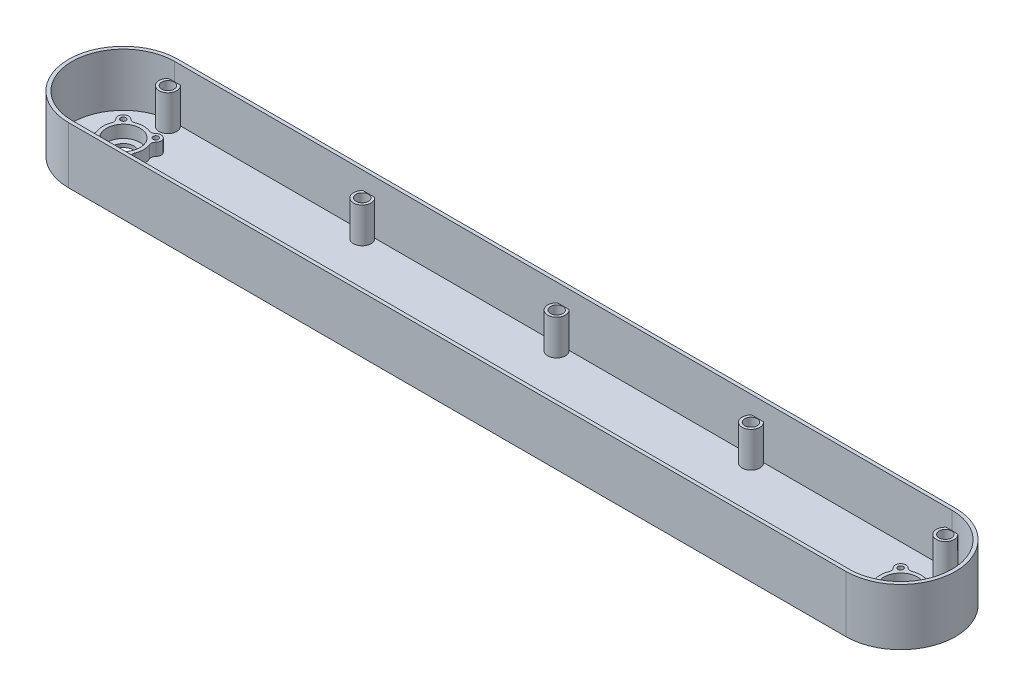
from build123d import *

# Parameters (mm, degrees)
BOSS_EXTRUDE1_DEPTH   = 30
SKETCH2_R             = 9.5
SKETCH2_R_2           = 1.5
BOSS_EXTRUDE2_DEPTH   = 7
BOSS_EXTRUDE2_2_DEPTH = 7
BOSS_EXTRUDE3_START   = -2
SKETCH3_3_R           = 2
BOSS_EXTRUDE3_DEPTH   = 2
SKETCH2_5_R           = 6
CUT_EXTRUDE2_DEPTH    = 3
SKETCH3_6_R           = 3.5
BOSS_EXTRUDE15_DEPTH  = 20
SKETCH3_10_R          = 3.5
SKETCH3_10_R_2        = 2
BOSS_EXTRUDE16_DEPTH  = 15
CUT_EXTRUDE3_START    = -2
SKETCH3_11_R          = 3.5
CUT_EXTRUDE3_DEPTH    = 3
LPATTERN3_COUNT       = 3
LPATTERN3_PITCH       = 110
LPATTERN3_COL_COUNT   = 3
LPATTERN3_COL_PITCH   = 110


with BuildPart() as part:
    # Sketch3 → Boss-Extrude1 (new body)
    with BuildSketch(Plane(origin=(0, 0, 0), x_dir=(1, 0, 0), z_dir=(0, 1, 0))):
        with BuildLine():
            Line((220, 31), (-220, 31))
            ThreePointArc((-220, 31), (-251, 0), (-220, -31))
            Line((-220, -31), (220, -31))
            ThreePointArc((220, -31), (251, 0), (220, 31))
        make_face()
        with BuildLine():
            Line((220, -29), (-220, -29))
            ThreePointArc((-220, -29), (-249, 0), (-220, 29))
            Line((-220, 29), (220, 29))
            ThreePointArc((220, 29), (249, 0), (220, -29))
        make_face(mode=Mode.SUBTRACT)
    extrude(amount=BOSS_EXTRUDE1_DEPTH)



with BuildPart() as body_2:
    # Sketch2 → Boss-Extrude2 (new body)
    with BuildSketch(Plane(origin=(0, 0, 0), x_dir=(1, 0, 0), z_dir=(0, 1, 0))):
        with BuildLine():
            ThreePointArc((230.710286287, 4.188050578), (230.58255933, 5.71944158), (231.313708499, 7.071067812))
            ThreePointArc((231.313708499, 7.071067812), (231.313708499, 11.313708499), (227.071067812, 11.313708499))
            ThreePointArc((227.071067812, 11.313708499), (225.71944158, 10.58255933), (224.188050578, 10.710286287))
            ThreePointArc((224.188050578, 10.710286287), (220, 11.5), (215.811949422, 10.710286287))
            ThreePointArc((215.811949422, 10.710286287), (214.28055842, 10.58255933), (212.928932188, 11.313708499))
            ThreePointArc((212.928932188, 11.313708499), (208.686291501, 11.313708499), (208.686291501, 7.071067812))
            ThreePointArc((208.686291501, 7.071067812), (209.41744067, 5.71944158), (209.289713713, 4.188050578))
            ThreePointArc((209.289713713, 4.188050578), (208.5, 0), (209.289713713, -4.188050578))
            ThreePointArc((209.289713713, -4.188050578), (209.41744067, -5.71944158), (208.686291501, -7.071067812))
            ThreePointArc((208.686291501, -7.071067812), (208.686291501, -11.313708499), (212.928932188, -11.313708499))
            ThreePointArc((212.928932188, -11.313708499), (214.28055842, -10.58255933), (215.811949422, -10.710286287))
            ThreePointArc((215.811949422, -10.710286287), (220, -11.5), (224.188050578, -10.710286287))
            ThreePointArc((224.188050578, -10.710286287), (225.71944158, -10.58255933), (227.071067812, -11.313708499))
            ThreePointArc((227.071067812, -11.313708499), (231.313708499, -11.313708499), (231.313708499, -7.071067812))
            ThreePointArc((231.313708499, -7.071067812), (230.58255933, -5.71944158), (230.710286287, -4.188050578))
            ThreePointArc((230.710286287, -4.188050578), (231.5, 0), (230.710286287, 4.188050578))
        make_face()
        with Locations(Location((220, 0, 0), (0, 0, 270))):
            Circle(SKETCH2_R, mode=Mode.SUBTRACT)
        with Locations(Location((229.192388155, 9.192388155, 0), (0, 0, 270))):
            Circle(SKETCH2_R_2, mode=Mode.SUBTRACT)
        with Locations(Location((229.192388155, -9.192388155, 0), (0, 0, 270))):
            Circle(SKETCH2_R_2, mode=Mode.SUBTRACT)
        with Locations(Location((210.807611845, 9.192388155, 0), (0, 0, 270))):
            Circle(SKETCH2_R_2, mode=Mode.SUBTRACT)
        with Locations(Location((210.807611845, -9.192388155, 0), (0, 0, 270))):
            Circle(SKETCH2_R_2, mode=Mode.SUBTRACT)
    extrude(amount=BOSS_EXTRUDE2_DEPTH)


with BuildPart() as body_3:
    # Sketch2 → Boss-Extrude2 2 (new body)
    with BuildSketch(Plane(origin=(0, 0, 0), x_dir=(1, 0, 0), z_dir=(0, 1, 0))):
        with BuildLine():
            ThreePointArc((-208.686291501, 7.071067812), (-208.686291501, 11.313708499), (-212.928932188, 11.313708499))
            ThreePointArc((-212.928932188, 11.313708499), (-214.28055842, 10.58255933), (-215.811949422, 10.710286287))
            ThreePointArc((-215.811949422, 10.710286287), (-220, 11.5), (-224.188050578, 10.710286287))
            ThreePointArc((-224.188050578, 10.710286287), (-225.71944158, 10.58255933), (-227.071067812, 11.313708499))
            ThreePointArc((-227.071067812, 11.313708499), (-231.313708499, 11.313708499), (-231.313708499, 7.071067812))
            ThreePointArc((-231.313708499, 7.071067812), (-230.58255933, 5.71944158), (-230.710286287, 4.188050578))
            ThreePointArc((-230.710286287, 4.188050578), (-231.5, 0), (-230.710286287, -4.188050578))
            ThreePointArc((-230.710286287, -4.188050578), (-230.58255933, -5.71944158), (-231.313708499, -7.071067812))
            ThreePointArc((-231.313708499, -7.071067812), (-231.313708499, -11.313708499), (-227.071067812, -11.313708499))
            ThreePointArc((-227.071067812, -11.313708499), (-225.71944158, -10.58255933), (-224.188050578, -10.710286287))
            ThreePointArc((-224.188050578, -10.710286287), (-220, -11.5), (-215.811949422, -10.710286287))
            ThreePointArc((-215.811949422, -10.710286287), (-214.28055842, -10.58255933), (-212.928932188, -11.313708499))
            ThreePointArc((-212.928932188, -11.313708499), (-208.686291501, -11.313708499), (-208.686291501, -7.071067812))
            ThreePointArc((-208.686291501, -7.071067812), (-209.41744067, -5.71944158), (-209.289713713, -4.188050578))
            ThreePointArc((-209.289713713, -4.188050578), (-208.5, 0), (-209.289713713, 4.188050578))
            ThreePointArc((-209.289713713, 4.188050578), (-209.41744067, 5.71944158), (-208.686291501, 7.071067812))
        make_face()
        with Locations(Location((-210.807611845, 9.192388155, 0), (0, 0, 270))):
            Circle(SKETCH2_R_2, mode=Mode.SUBTRACT)
        with Locations(Location((-220, 0, 0), (0, 0, 270))):
            Circle(SKETCH2_R, mode=Mode.SUBTRACT)
        with Locations(Location((-229.192388155, 9.192388155, 0), (0, 0, 270))):
            Circle(SKETCH2_R_2, mode=Mode.SUBTRACT)
        with Locations(Location((-210.807611845, -9.192388155, 0), (0, 0, 270))):
            Circle(SKETCH2_R_2, mode=Mode.SUBTRACT)
        with Locations(Location((-229.192388155, -9.192388155, 0), (0, 0, 270))):
            Circle(SKETCH2_R_2, mode=Mode.SUBTRACT)
    extrude(amount=BOSS_EXTRUDE2_2_DEPTH)


with BuildPart() as part_1:
    add(part.part)

    add(body_2.part)  # Boss-Extrude3 merges body 2

    add(body_3.part)  # Boss-Extrude3 merges body 3
    # Sketch3<3> → Boss-Extrude3 (add)
    with BuildSketch(Plane(origin=(0, 0, 0), x_dir=(1, 0, 0), z_dir=(0, 1, 0)).offset(BOSS_EXTRUDE3_START)):
        with BuildLine():
            Line((220, 31), (-220, 31))
            ThreePointArc((-220, 31), (-251, 0), (-220, -31))
            Line((-220, -31), (220, -31))
            ThreePointArc((220, -31), (251, 0), (220, 31))
        make_face()
        with Locations(Location((0, 25.25, 0), (0, 0, 270))):
            Circle(SKETCH3_3_R, mode=Mode.SUBTRACT)
        with Locations(Location((0, -25.25, 0), (0, 0, 270))):
            Circle(SKETCH3_3_R, mode=Mode.SUBTRACT)
    boss_extrude3 = extrude(amount=BOSS_EXTRUDE3_DEPTH)

    # Mirror4: Boss-Extrude3 across plane
    add(boss_extrude3.mirror(Plane(origin=(0, 0, 0), x_dir=(0, 0, 1), z_dir=(1, 0, 0))))

    # Sketch2<5> → Cut-Extrude2 (cut)
    with BuildSketch(Plane(origin=(0, 0, 0), x_dir=(1, 0, 0), z_dir=(0, 1, 0))):
        with Locations(Location((220, 0, 0), (0, 0, 270))):
            Circle(SKETCH2_5_R)
        with Locations(Location((-220, 0, 0), (0, 0, 270))):
            Circle(SKETCH2_5_R)
    extrude(amount=-CUT_EXTRUDE2_DEPTH, mode=Mode.SUBTRACT)

    # Sketch3<6> → Boss-Extrude15 (add)
    # profile 1 of 2: a face of its own
    with BuildSketch(Plane(origin=(0, 0, 0), x_dir=(1, 0, 0), z_dir=(0, 1, 0))):
        with BuildLine():
            ThreePointArc((-3.307189139, 29), (0, 20.25), (3.307189139, 29))
            Line((3.307189139, 29), (-3.307189139, 29))
        make_face()
        with Locations(Location((0, 25.25, 0), (0, 0, 270))):
            Circle(SKETCH3_6_R, mode=Mode.SUBTRACT)
    # profile 2 of 2: a face of its own
    with BuildSketch(Plane(origin=(0, 0, 0), x_dir=(1, 0, 0), z_dir=(0, 1, 0))):
        with BuildLine():
            Line((-3.307189139, -29), (3.307189139, -29))
            ThreePointArc((3.307189139, -29), (0, -20.25), (-3.307189139, -29))
        make_face()
        with Locations(Location((0, -25.25, 0), (0, 0, 270))):
            Circle(SKETCH3_6_R, mode=Mode.SUBTRACT)
    boss_extrude15 = extrude(amount=BOSS_EXTRUDE15_DEPTH)

    # Sketch3<10> → Boss-Extrude16 (add)
    # profile 1 of 2: a face of its own
    with BuildSketch(Plane(origin=(0, 0, 0), x_dir=(1, 0, 0), z_dir=(0, 1, 0))):
        with Locations(Location((0, -25.25, 0), (0, 0, 270))):
            Circle(SKETCH3_10_R)
        with Locations(Location((0, -25.25, 0), (0, 0, 270))):
            Circle(SKETCH3_10_R_2, mode=Mode.SUBTRACT)
    # profile 2 of 2: a face of its own
    with BuildSketch(Plane(origin=(0, 0, 0), x_dir=(1, 0, 0), z_dir=(0, 1, 0))):
        with Locations(Location((0, 25.25, 0), (0, 0, 270))):
            Circle(SKETCH3_10_R)
        with Locations(Location((0, 25.25, 0), (0, 0, 270))):
            Circle(SKETCH3_10_R_2, mode=Mode.SUBTRACT)
    boss_extrude16 = extrude(amount=BOSS_EXTRUDE16_DEPTH)

    # Sketch3<11> → Cut-Extrude3 (cut)
    with BuildSketch(Plane(origin=(0, 0, 0), x_dir=(1, 0, 0), z_dir=(0, 1, 0)).offset(CUT_EXTRUDE3_START)):
        with Locations(Location((0, 25.25, 0), (0, 0, 270))):
            Circle(SKETCH3_11_R)
        with Locations(Location((0, -25.25, 0), (0, 0, 270))):
            Circle(SKETCH3_11_R)
    cut_extrude3 = extrude(amount=CUT_EXTRUDE3_DEPTH, mode=Mode.SUBTRACT)

    # LPattern3: Boss-Extrude15, Boss-Extrude16, Cut-Extrude3 ×3
    with Locations(*[(i * LPATTERN3_PITCH, 0, 0) for i in range(1, LPATTERN3_COUNT)]):
        add(boss_extrude15)
        add(boss_extrude16)
        add(cut_extrude3, mode=Mode.SUBTRACT)

    # LPattern3 col: Boss-Extrude15, Boss-Extrude16, Cut-Extrude3 ×3
    with Locations(*[(-i * LPATTERN3_COL_PITCH, 0, 0) for i in range(1, LPATTERN3_COL_COUNT)]):
        add(boss_extrude15)
        add(boss_extrude16)
        add(cut_extrude3, mode=Mode.SUBTRACT)


solid = part_1.part
